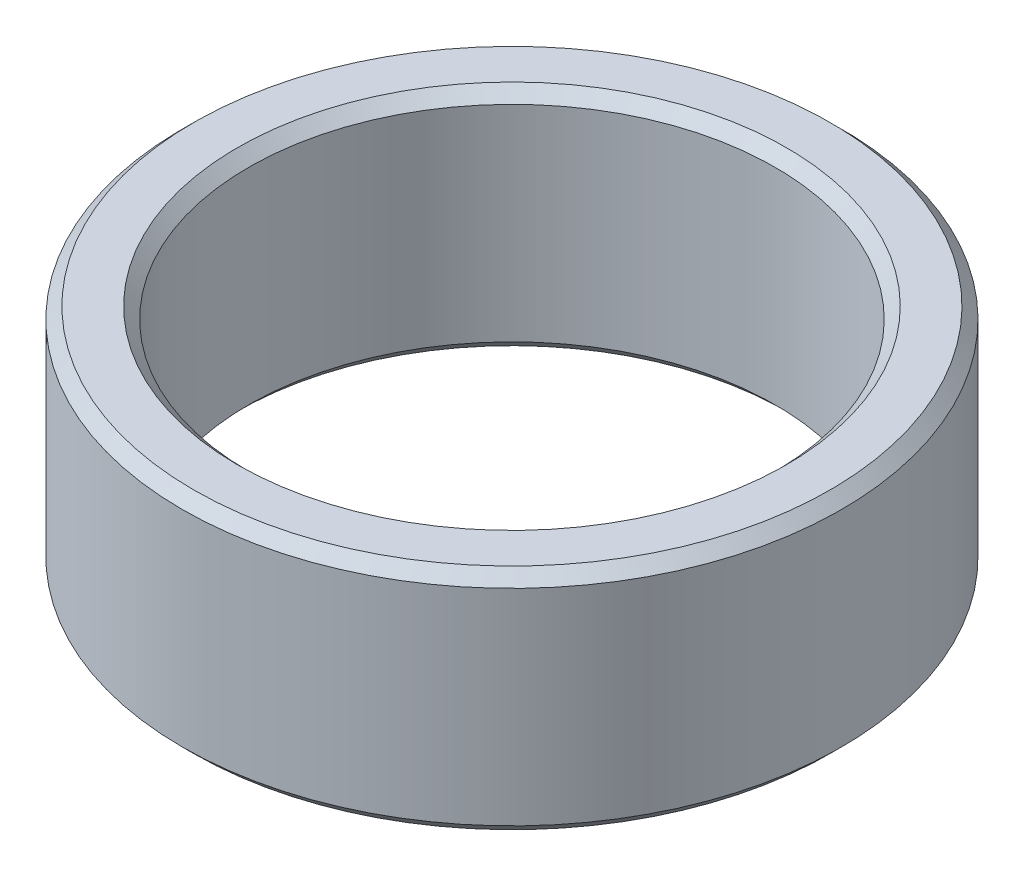
from build123d import *

# Parameters (mm, degrees)
SKETCH1_R           = 50
BOSS_EXTRUDE1_DEPTH = 34.641815438
SKETCH2_R           = 39.941284541
CUT_EXTRUDE1_DEPTH  = 79.740430383
CHAMFER1_SIZE       = 1.7187438


with BuildPart() as part:
    # Sketch1 → Boss-Extrude1 (new body)
    with BuildSketch(Plane(origin=(0, 0, 0), x_dir=(1, 0, 0), z_dir=(0, 1, 0))):
        Circle(SKETCH1_R)
    extrude(amount=BOSS_EXTRUDE1_DEPTH)

    # Sketch2 → Cut-Extrude1 (cut, through all)
    with BuildSketch(Plane(origin=(0, 0, 0), x_dir=(1, 0, 0), z_dir=(0, 1, 0))):
        Circle(SKETCH2_R)
    extrude(amount=CUT_EXTRUDE1_DEPTH, mode=Mode.SUBTRACT)

    # Chamfer1
    chamfer1_edges = [part.edges().sort_by_distance(p)[0] for p in [
        (-39.941284541, 34.641815438, 0),
        (-39.941284541, 0, 0),
        (-50, 0, 0),
        (-50, 34.641815438, 0),
    ]]
    chamfer(chamfer1_edges, length=CHAMFER1_SIZE)


solid = part.part
